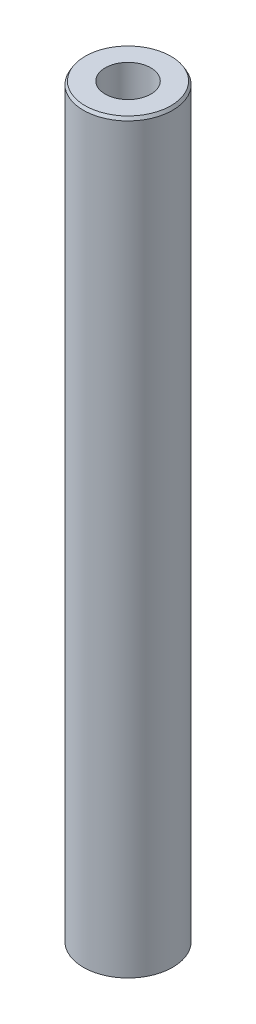
from build123d import *
from OCP.BRepFilletAPI import BRepFilletAPI_MakeChamfer

# Parameters (mm, degrees)
SKETCH1_R           = 10
BOSS_EXTRUDE1_DEPTH = 167.340942336
SKETCH2_R           = 5.113909436
CUT_EXTRUDE1_DEPTH  = 168.937461521
CHAMFER1_SIZE       = 0.685164914
CHAMFER1_SIZE2      = 0.395580147


with BuildPart() as part:
    # Sketch1 → Boss-Extrude1 (new body)
    with BuildSketch(Plane(origin=(0, 0, 0), x_dir=(1, 0, 0), z_dir=(0, 1, 0))):
        Circle(SKETCH1_R)
    extrude(amount=BOSS_EXTRUDE1_DEPTH)

    # Sketch2 → Cut-Extrude1 (cut, through all)
    with BuildSketch(Plane(origin=(0, 0, 0), x_dir=(1, 0, 0), z_dir=(0, 1, 0))):
        Circle(SKETCH2_R)
    extrude(amount=CUT_EXTRUDE1_DEPTH, mode=Mode.SUBTRACT)

    # Chamfer1: one chamfer whose edges measure the first distance from different faces: ONE call of the kernel's chamfer builder (chamfer() names one face for all edges)
    chamfer1_edges_1 = [part.edges().sort_by_distance(p)[0] for p in [
        (-10, 167.340942336, 0),
    ]]
    chamfer1_side_1 = [part.faces().sort_by_distance(p)[0] for p in [
        (-10, 83.670471168, 0),
    ]]
    chamfer1_edges_2 = [part.edges().sort_by_distance(p)[0] for p in [
        (-10, 0, 0),
    ]]
    chamfer1_side_2 = [part.faces().sort_by_distance(p)[0] for p in [
        (-9.717157288, 0, 0),
    ]]
    chamfer1 = BRepFilletAPI_MakeChamfer(part.part.solid().wrapped)
    for e in chamfer1_edges_1:
        chamfer1.Add(CHAMFER1_SIZE, CHAMFER1_SIZE2, e.wrapped, chamfer1_side_1[0].wrapped)  # the first distance lies on this face
    for e in chamfer1_edges_2:
        chamfer1.Add(CHAMFER1_SIZE, CHAMFER1_SIZE2, e.wrapped, chamfer1_side_2[0].wrapped)  # the first distance lies on this face
    add(Compound.cast(chamfer1.Shape()), mode=Mode.REPLACE)


solid = part.part
